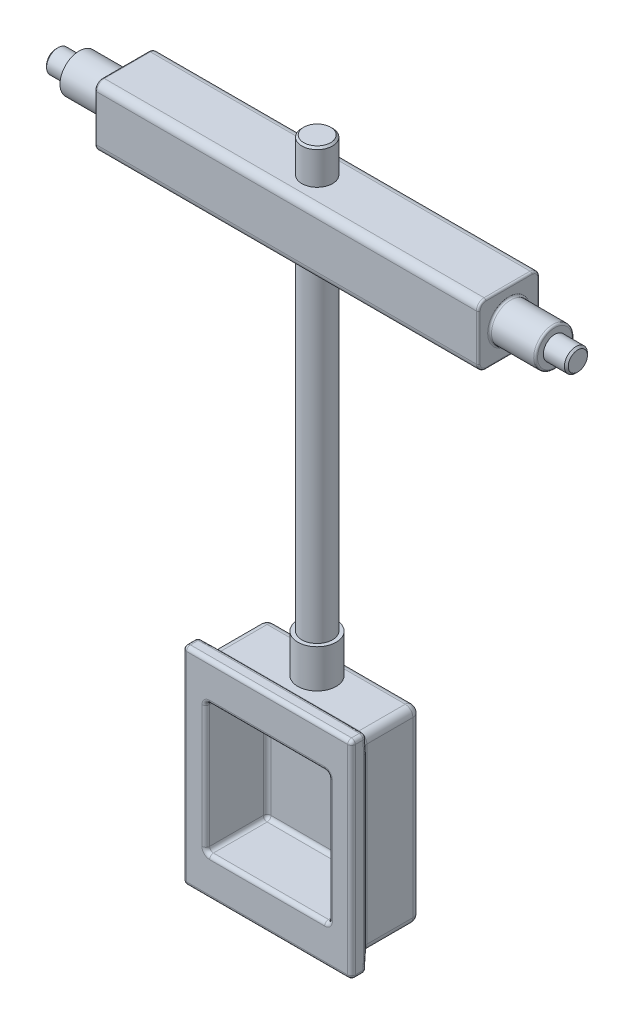
from build123d import *

# Parameters (mm, degrees)
SKETCH1_W                       = 22
SKETCH1_H                       = 27
SKETCH1_W_2                     = 20
SKETCH1_H_2                     = 24.6
SKETCH1_W_3                     = 16
SKETCH1_H_3                     = 17
BOSS_EXTRUDE1_DEPTH             = 2
SKETCH1_3_W                     = 20
SKETCH1_3_H                     = 24.6
SKETCH1_3_W_2                   = 16
SKETCH1_3_H_2                   = 17
BOSS_EXTRUDE2_DEPTH             = 8
SKETCH1_5_W                     = 16
SKETCH1_5_H                     = 17
CUT_EXTRUDE1_DEPTH              = 6
CUT_EXTRUDE1_DIRECTION_2_REACH  = 21.164
SKETCH2_R                       = 2.5
BOSS_EXTRUDE3_DEPTH             = 5
M3X0_5_TAPPED_HOLE1_D           = 2.5
M3X0_5_TAPPED_HOLE1_DEPTH       = 4.248924226
M3X0_5_TAPPED_HOLE1_CSINK_D     = 3.05
M3X0_5_TAPPED_HOLE1_CSINK_ANGLE = 90
M3X0_5_TAPPED_HOLE1_TIP         = 0.751075774
BOSS_EXTRUDE4_DEPTH             = 25
SKETCH8_R                       = 2
CUT_EXTRUDE3_DEPTH              = 8
CHAMFER1_SIZE                   = 0.25
CHAMFER2_SIZE                   = 0.25
FILLET1_R                       = 0.25
FILLET3_R                       = 1
FILLET4_R                       = 0.5


with BuildPart() as part:
    # Sketch1 → Boss-Extrude1 (new body)
    # profile 1 of 3: a face of its own
    with BuildSketch(Plane.XY):
        Rectangle(SKETCH1_W, SKETCH1_H)
        Rectangle(SKETCH1_W_2, SKETCH1_H_2, mode=Mode.SUBTRACT)
    # profile 2 of 3: a face of its own
    with BuildSketch(Plane.XY):
        Rectangle(SKETCH1_W_2, SKETCH1_H_2)
        Rectangle(SKETCH1_W_3, SKETCH1_H_3, mode=Mode.SUBTRACT)
    # profile 3 of 3: a face of its own
    with BuildSketch(Plane.XY):
        Rectangle(SKETCH1_W_3, SKETCH1_H_3)
    extrude(amount=BOSS_EXTRUDE1_DEPTH)

    # Sketch1<3> → Boss-Extrude2 (add)
    # profile 1 of 2: a face of its own
    with BuildSketch(Plane.XY):
        Rectangle(SKETCH1_3_W, SKETCH1_3_H)
        Rectangle(SKETCH1_3_W_2, SKETCH1_3_H_2, mode=Mode.SUBTRACT)
    # profile 2 of 2: a face of its own
    with BuildSketch(Plane.XY):
        Rectangle(SKETCH1_3_W_2, SKETCH1_3_H_2)
    extrude(amount=-BOSS_EXTRUDE2_DEPTH)

    # Sketch1<5> → Cut-Extrude1 (cut)
    with BuildSketch(Plane.XY):
        Rectangle(SKETCH1_5_W, SKETCH1_5_H)
    extrude(amount=-CUT_EXTRUDE1_DEPTH, mode=Mode.SUBTRACT)

    # Sketch1<5> → Cut-Extrude1 direction 2 (cut, up to next)
    with BuildSketch(Plane.XY, mode=Mode.PRIVATE) as cut_extrude1_direction_2_sk1:
        Rectangle(SKETCH1_5_W, SKETCH1_5_H)
    cut_extrude1_direction_2_tool1 = extrude(cut_extrude1_direction_2_sk1.sketch, amount=CUT_EXTRUDE1_DIRECTION_2_REACH, mode=Mode.PRIVATE) & part.part
    add(cut_extrude1_direction_2_tool1.solids().sort_by_distance((0, 0, 0))[0], mode=Mode.SUBTRACT)

    # Sketch2 → Boss-Extrude3 (add)
    with BuildSketch(Plane(origin=(0, 12.3, 0), x_dir=(1, 0, 0), z_dir=(0, 1, 0))):
        with Locations((0, 4.5)):
            Circle(SKETCH2_R)
    extrude(amount=BOSS_EXTRUDE3_DEPTH)

    # M3x0.5 Tapped Hole1
    with Locations(Plane(origin=(0, 17.3, 0), x_dir=(1, 0, 0), z_dir=(0, 1, 0))):
        with Locations((0, 4.5)):
            CounterSinkHole(M3X0_5_TAPPED_HOLE1_D / 2, M3X0_5_TAPPED_HOLE1_CSINK_D / 2, depth=M3X0_5_TAPPED_HOLE1_DEPTH, counter_sink_angle=M3X0_5_TAPPED_HOLE1_CSINK_ANGLE)
            with Locations((0, 0, -(M3X0_5_TAPPED_HOLE1_DEPTH + M3X0_5_TAPPED_HOLE1_TIP / 2))):  # 118° drill point
                Cone(0, M3X0_5_TAPPED_HOLE1_D / 2, M3X0_5_TAPPED_HOLE1_TIP, mode=Mode.SUBTRACT)

    # Fillet3
    fillet3_edges = [part.edges().sort_by_distance(p)[0] for p in [
        (0, -12.3, -8),
        (10, -12.3, -4),
        (-10, 0, 0),
        (-10, -12.3, -4),
        (0, 12.3, 0),
        (-10, 12.3, -4),
        (10, 0, -8),
        (10, 12.3, -4),
        (-10, 0, -8),
        (0, 12.3, -8),
        (0, -12.3, 0),
        (10, 0, 0),
    ]]
    fillet(fillet3_edges, radius=FILLET3_R - 0.0001)  # a hair under: the kernel refuses the full size

    # Fillet4
    fillet4_edges = [part.edges().sort_by_distance(p)[0] for p in [
        (0, 8.5, 2),
        (8, 8.5, -2),
        (8, 0, 2),
        (8, -8.5, -2),
        (0, -8.5, 2),
        (0, 8.5, -6),
        (8, 0, -6),
        (0, -8.5, -6),
        (-8, 0, 2),
        (-8, 8.5, -2),
        (-8, 0, -6),
        (-8, -8.5, -2),
        (-11, 0, 0),
        (-11, 0, 0),
        (-11, 0, 2),
        (-11, 0, 0),
        (-11, -13.5, 1),
        (0, -13.5, 2),
        (0, -13.5, 0),
        (11, -13.5, 1),
        (11, 0, 2),
        (11, 0, 0),
        (11, 0, 0),
        (11, 0, 0),
        (11, 13.5, 1),
        (0, 13.5, 2),
        (-11, 13.5, 1),
        (0, 13.5, 0),
    ]]
    fillet(fillet4_edges, radius=FILLET4_R)


with BuildPart() as body_2:
    # Sketch6 → Revolve1 (revolve)
    with BuildSketch(Plane(origin=(0, 0, 0), x_dir=(0, 0, -1), z_dir=(1, 0, 0))):
        Polygon((4.525, 12.3), (4.525, 73.3), (6.525, 73.3), (6.525, 17.3), (6.025, 17.3), (6.025, 12.3), align=None)
    revolve(axis=Axis((0, 12.3, -4.525), (0, 1, 0)))

    # Chamfer1
    chamfer1_edges = [body_2.edges().sort_by_distance(p)[0] for p in [
        (0, 12.3, -3.025),
        (0, 73.3, -2.525),
    ]]
    chamfer(chamfer1_edges, length=CHAMFER1_SIZE)


with BuildPart() as body_3:
    # Sketch7 → Boss-Extrude4 (new, symmetric)
    with BuildSketch(Plane(origin=(0, 0, 0), x_dir=(0, 0, -1), z_dir=(1, 0, 0))):
        with BuildLine():
            Line((1.525, 60.8), (7.525, 60.8))
            ThreePointArc((7.525, 60.8), (8.232106781, 61.092893219), (8.525, 61.8))
            Line((8.525, 61.8), (8.525, 67.8))
            ThreePointArc((8.525, 67.8), (8.232106781, 68.507106781), (7.525, 68.8))
            Line((7.525, 68.8), (1.525, 68.8))
            ThreePointArc((1.525, 68.8), (0.817893219, 68.507106781), (0.525, 67.8))
            Line((0.525, 67.8), (0.525, 61.8))
            ThreePointArc((0.525, 61.8), (0.817893219, 61.092893219), (1.525, 60.8))
        make_face()
    extrude(amount=BOSS_EXTRUDE4_DEPTH, both=True)

    # Sketch8 → Cut-Extrude3 (cut)
    with BuildSketch(Plane(origin=(0, 68.8, 0), x_dir=(1, 0, 0), z_dir=(0, 1, 0))):
        with Locations(Location((0, 4.525, 0), (0, 0, 270))):
            Circle(SKETCH8_R)
    extrude(amount=-CUT_EXTRUDE3_DEPTH, mode=Mode.SUBTRACT)

    # Sketch10 → Revolve2 (revolve)
    with BuildSketch(Plane.XY.offset(-4.5)):
        Polygon((25, 64.8), (25, 67.3), (31, 67.3), (31, 66.3), (34, 66.3), (34, 64.8), align=None)
        Polygon((-31, 67.3), (-31, 66.3), (-34, 66.3), (-34, 64.8), (-25, 64.8), (-25, 67.3), align=None)
    revolve(axis=Axis((54.091620536, 64.8, -4.5), (-1, 0, 0)))

    # Chamfer2
    chamfer2_edges = [body_3.edges().sort_by_distance(p)[0] for p in [
        (34, 63.3, -4.5),
        (-34, 63.3, -4.5),
    ]]
    chamfer(chamfer2_edges, length=CHAMFER2_SIZE)

    # Fillet1
    fillet1_edges = [body_3.edges().sort_by_distance(p)[0] for p in [
        (-25, 60.8, -4.525),
        (-25, 61.092893219, -0.817893219),
        (-25, 64.8, -0.525),
        (-25, 68.507106781, -0.817893219),
        (25, 61.092893219, -0.817893219),
        (25, 60.8, -4.525),
        (25, 61.092893219, -8.232106781),
        (25, 64.8, -8.525),
        (25, 68.507106781, -8.232106781),
        (25, 62.3, -4.5),
        (31, 62.3, -4.5),
        (25, 68.8, -4.525),
        (-25, 62.3, -4.5),
        (25, 68.507106781, -0.817893219),
        (-25, 68.8, -4.525),
        (25, 64.8, -0.525),
        (-25, 68.507106781, -8.232106781),
        (-25, 64.8, -8.525),
        (-25, 61.092893219, -8.232106781),
    ]]
    fillet(fillet1_edges, radius=FILLET1_R)


solid = Compound([part.part, body_2.part, body_3.part])
